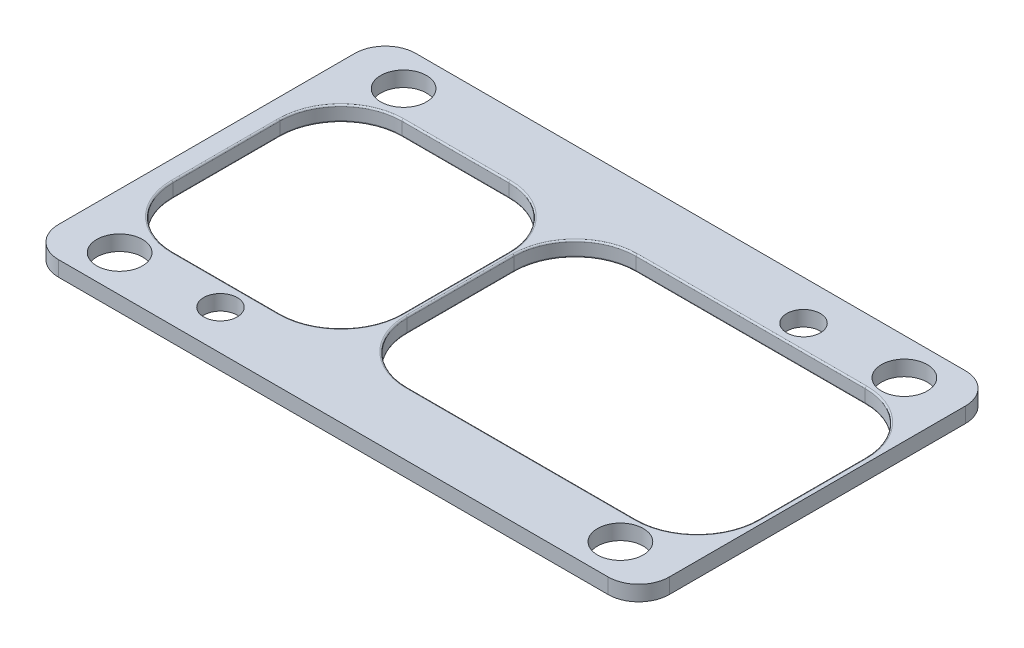
from build123d import *

# Parameters (mm, degrees)
SKETCH1_W           = 200
SKETCH1_H           = 117
SKETCH1_R           = 7.5
BOSS_EXTRUDE1_DEPTH = 5
SKETCH6_R           = 5.5
CUT_EXTRUDE7_DEPTH  = 10
FILLET2_R           = 10
FILLET3_R           = 0.5


with BuildPart() as part:
    # Sketch1 → Boss-Extrude1 (new body)
    with BuildSketch(Plane(origin=(0, 0, 0), x_dir=(1, 0, 0), z_dir=(0, 1, 0))):
        with Locations((100, 58.5)):
            Rectangle(SKETCH1_W, SKETCH1_H)
        with Locations((18, 105)):
            Circle(SKETCH1_R, mode=Mode.SUBTRACT)
        with Locations((18, 12)):
            Circle(SKETCH1_R, mode=Mode.SUBTRACT)
        with Locations((182, 105)):
            Circle(SKETCH1_R, mode=Mode.SUBTRACT)
        with Locations((182, 12)):
            Circle(SKETCH1_R, mode=Mode.SUBTRACT)
    extrude(amount=BOSS_EXTRUDE1_DEPTH)

    # Sketch6 → Cut-Extrude7 (cut)
    with BuildSketch(Plane(origin=(0, 5, 0), x_dir=(1, 0, 0), z_dir=(0, 1, 0))):
        with Locations((50, 13.02)):
            Circle(SKETCH6_R)
        with Locations((150, 103.98)):
            Circle(SKETCH6_R)
        with BuildLine():
            Line((26.46757137, 96), (61.46757137, 96))
            ThreePointArc((61.46757137, 96), (75.609706994, 90.142135624), (81.46757137, 76))
            Line((81.46757137, 76), (81.46757137, 41))
            ThreePointArc((81.46757137, 41), (75.609706994, 26.857864376), (61.46757137, 21))
            Line((61.46757137, 21), (26.46757137, 21))
            ThreePointArc((26.46757137, 21), (12.325435746, 26.857864376), (6.46757137, 41))
            Line((6.46757137, 41), (6.46757137, 76))
            ThreePointArc((6.46757137, 76), (12.325435746, 90.142135624), (26.46757137, 96))
        make_face()
        with BuildLine():
            Line((103.1891021, 96), (178.1891021, 96))
            ThreePointArc((178.1891021, 96), (192.331237724, 90.142135624), (198.1891021, 76))
            Line((198.1891021, 76), (198.1891021, 41))
            ThreePointArc((198.1891021, 41), (192.331237724, 26.857864376), (178.1891021, 21))
            Line((178.1891021, 21), (103.1891021, 21))
            ThreePointArc((103.1891021, 21), (89.046966476, 26.857864376), (83.1891021, 41))
            Line((83.1891021, 41), (83.1891021, 76))
            ThreePointArc((83.1891021, 76), (89.046966476, 90.142135624), (103.1891021, 96))
        make_face()
    extrude(amount=-CUT_EXTRUDE7_DEPTH, mode=Mode.SUBTRACT)

    # Fillet2
    fillet2_edges = [part.edges().sort_by_distance(p)[0] for p in [
        (200, 2.5, 0),
        (200, 2.5, -117),
        (0, 2.5, -117),
        (0, 2.5, 0),
    ]]
    fillet(fillet2_edges, radius=FILLET2_R)

    # Fillet3
    fillet3_edges = [part.edges().sort_by_distance(p)[0] for p in [
        (43.96757137, 0, -21),
        (12.325435746, 0, -26.857864376),
        (6.46757137, 0, -58.5),
        (12.325435746, 0, -90.142135624),
        (43.96757137, 0, -96),
        (75.609706994, 0, -90.142135624),
        (81.46757137, 0, -58.5),
        (89.046966476, 0, -26.857864376),
        (83.1891021, 0, -58.5),
        (89.046966476, 0, -90.142135624),
        (140.6891021, 0, -96),
        (192.331237724, 0, -90.142135624),
        (198.1891021, 0, -58.5),
        (192.331237724, 0, -26.857864376),
        (12.325435746, 5, -90.142135624),
        (6.46757137, 5, -58.5),
        (12.325435746, 5, -26.857864376),
        (43.96757137, 5, -21),
        (75.609706994, 5, -26.857864376),
        (81.46757137, 5, -58.5),
        (75.609706994, 5, -90.142135624),
        (89.046966476, 5, -90.142135624),
        (83.1891021, 5, -58.5),
        (89.046966476, 5, -26.857864376),
        (140.6891021, 5, -21),
        (192.331237724, 5, -26.857864376),
        (198.1891021, 5, -58.5),
        (192.331237724, 5, -90.142135624),
        (75.609706994, 0, -26.857864376),
        (140.6891021, 0, -21),
        (43.96757137, 5, -96),
        (140.6891021, 5, -96),
    ]]
    fillet(fillet3_edges, radius=FILLET3_R)


solid = part.part
